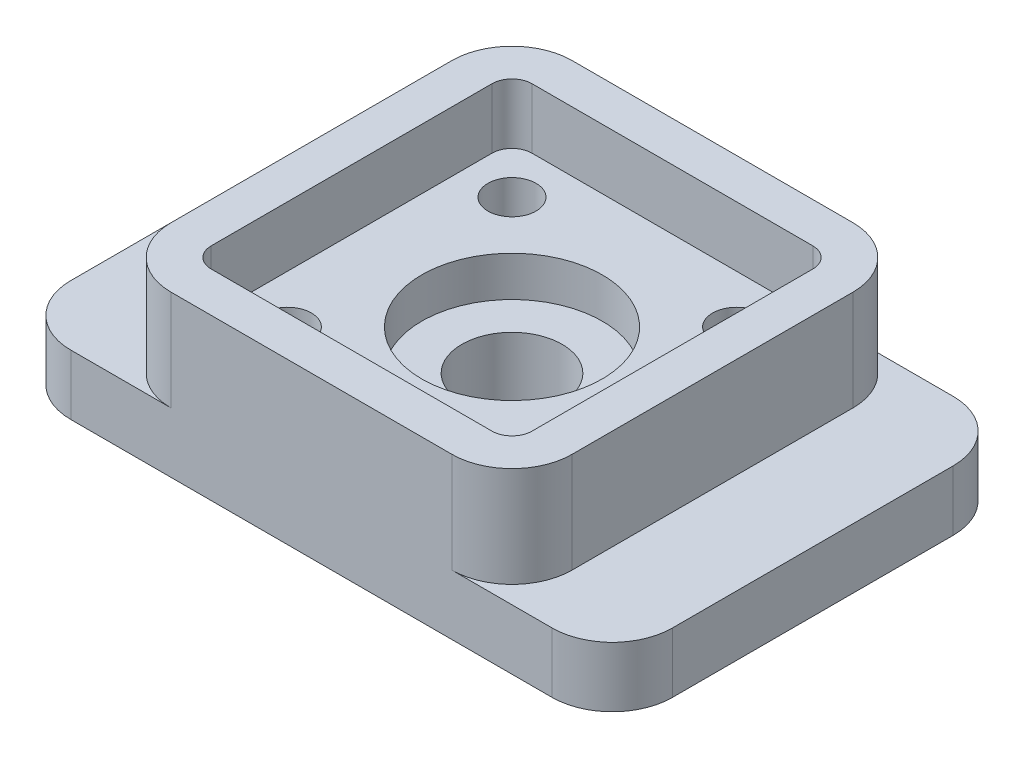
from build123d import *

# Parameters (mm, degrees)
CROQUIS3_R              = 12.5
CROQUIS3_R_2            = 6
CROQUIS3_R_3            = 5
SALIENTE_EXTRUIR1_DEPTH = 15
SALIENTE_EXTRUIR2_START = 15
CROQUIS4_R              = 7.5
SALIENTE_EXTRUIR2_DEPTH = 2
SALIENTE_EXTRUIR3_DEPTH = 40
CROQUIS6_R              = 22.5
CROQUIS6_R_2            = 6
SALIENTE_EXTRUIR4_DEPTH = 25


with BuildPart() as part:
    # Croquis3 → Saliente-Extruir1 (new body)
    with BuildSketch(Plane(origin=(0, 0, 0), x_dir=(1, 0, 0), z_dir=(0, 1, 0))):
        with BuildLine():
            Line((60, 50), (-60, 50))
            ThreePointArc((-60, 50), (-70.606601718, 45.606601718), (-75, 35))
            Line((-75, 35), (-75, -35))
            ThreePointArc((-75, -35), (-70.606601718, -45.606601718), (-60, -50))
            Line((-60, -50), (60, -50))
            ThreePointArc((60, -50), (70.606601718, -45.606601718), (75, -35))
            Line((75, -35), (75, 35))
            ThreePointArc((75, 35), (70.606601718, 45.606601718), (60, 50))
        make_face()
        with Locations(Location((0, 0, 0), (0, 0, 270))):
            Circle(CROQUIS3_R, mode=Mode.SUBTRACT)
        with Locations(Location((-28, -28, 0), (0, 0, 270))):
            Circle(CROQUIS3_R_2, mode=Mode.SUBTRACT)
        with Locations(Location((-28, 28, 0), (0, 0, 270))):
            Circle(CROQUIS3_R_2, mode=Mode.SUBTRACT)
        with Locations(Location((28, 28, 0), (0, 0, 270))):
            Circle(CROQUIS3_R_2, mode=Mode.SUBTRACT)
        with Locations(Location((60, 35, 0), (0, 0, 270))):
            Circle(CROQUIS3_R_3, mode=Mode.SUBTRACT)
        with Locations(Location((60, -35, 0), (0, 0, 270))):
            Circle(CROQUIS3_R_3, mode=Mode.SUBTRACT)
        with Locations(Location((-60, -35, 0), (0, 0, 270))):
            Circle(CROQUIS3_R_3, mode=Mode.SUBTRACT)
        with Locations(Location((-60, 35, 0), (0, 0, 270))):
            Circle(CROQUIS3_R_3, mode=Mode.SUBTRACT)
    extrude(amount=SALIENTE_EXTRUIR1_DEPTH)

    # Croquis4 → Saliente-Extruir2 (add)
    with BuildSketch(Plane(origin=(0, 0, 0), x_dir=(1, 0, 0), z_dir=(0, 1, 0)).offset(SALIENTE_EXTRUIR2_START)):
        with Locations((60, -35)):
            Circle(CROQUIS4_R)
        with Locations((60, 35)):
            Circle(CROQUIS4_R)
        with Locations((-60, 35)):
            Circle(CROQUIS4_R)
        with Locations((-60, -35)):
            Circle(CROQUIS4_R)
    extrude(amount=-SALIENTE_EXTRUIR2_DEPTH)

    # Croquis5 → Saliente-Extruir3 (add)
    with BuildSketch(Plane(origin=(0, 0, 0), x_dir=(1, 0, 0), z_dir=(0, 1, 0))):
        with BuildLine():
            Line((50, -35), (50, 35))
            ThreePointArc((50, 35), (45.606601718, 45.606601718), (35, 50))
            Line((35, 50), (-35, 50))
            ThreePointArc((-35, 50), (-45.606601718, 45.606601718), (-50, 35))
            Line((-50, 35), (-50, -35))
            ThreePointArc((-50, -35), (-45.606601718, -45.606601718), (-35, -50))
            Line((-35, -50), (35, -50))
            ThreePointArc((35, -50), (45.606601718, -45.606601718), (50, -35))
        make_face()
        with BuildLine():
            Line((35, 40), (-35, 40))
            ThreePointArc((-35, 40), (-38.535533906, 38.535533906), (-40, 35))
            Line((-40, 35), (-40, -35))
            ThreePointArc((-40, -35), (-38.535533906, -38.535533906), (-35, -40))
            Line((-35, -40), (35, -40))
            ThreePointArc((35, -40), (38.535533906, -38.535533906), (40, -35))
            Line((40, -35), (40, 35))
            ThreePointArc((40, 35), (38.535533906, 38.535533906), (35, 40))
        make_face(mode=Mode.SUBTRACT)
    extrude(amount=SALIENTE_EXTRUIR3_DEPTH)

    # Croquis6 → Saliente-Extruir4 (add)
    with BuildSketch(Plane(origin=(0, 0, 0), x_dir=(1, 0, 0), z_dir=(0, 1, 0))):
        with BuildLine():
            Line((-35, -40), (35, -40))
            ThreePointArc((35, -40), (38.535533906, -38.535533906), (40, -35))
            Line((40, -35), (40, 35))
            ThreePointArc((40, 35), (38.535533906, 38.535533906), (35, 40))
            Line((35, 40), (-35, 40))
            ThreePointArc((-35, 40), (-38.535533906, 38.535533906), (-40, 35))
            Line((-40, 35), (-40, -35))
            ThreePointArc((-40, -35), (-38.535533906, -38.535533906), (-35, -40))
        make_face()
        with Locations(Location((0, 0, 0), (0, 0, 270))):
            Circle(CROQUIS6_R, mode=Mode.SUBTRACT)
        with Locations(Location((28, 28, 0), (0, 0, 270))):
            Circle(CROQUIS6_R_2, mode=Mode.SUBTRACT)
        with Locations(Location((28, -28, 0), (0, 0, 270))):
            Circle(CROQUIS6_R_2, mode=Mode.SUBTRACT)
        with Locations(Location((-28, -28, 0), (0, 0, 270))):
            Circle(CROQUIS6_R_2, mode=Mode.SUBTRACT)
        with Locations(Location((-28, 28, 0), (0, 0, 270))):
            Circle(CROQUIS6_R_2, mode=Mode.SUBTRACT)
    extrude(amount=SALIENTE_EXTRUIR4_DEPTH)


solid = part.part
